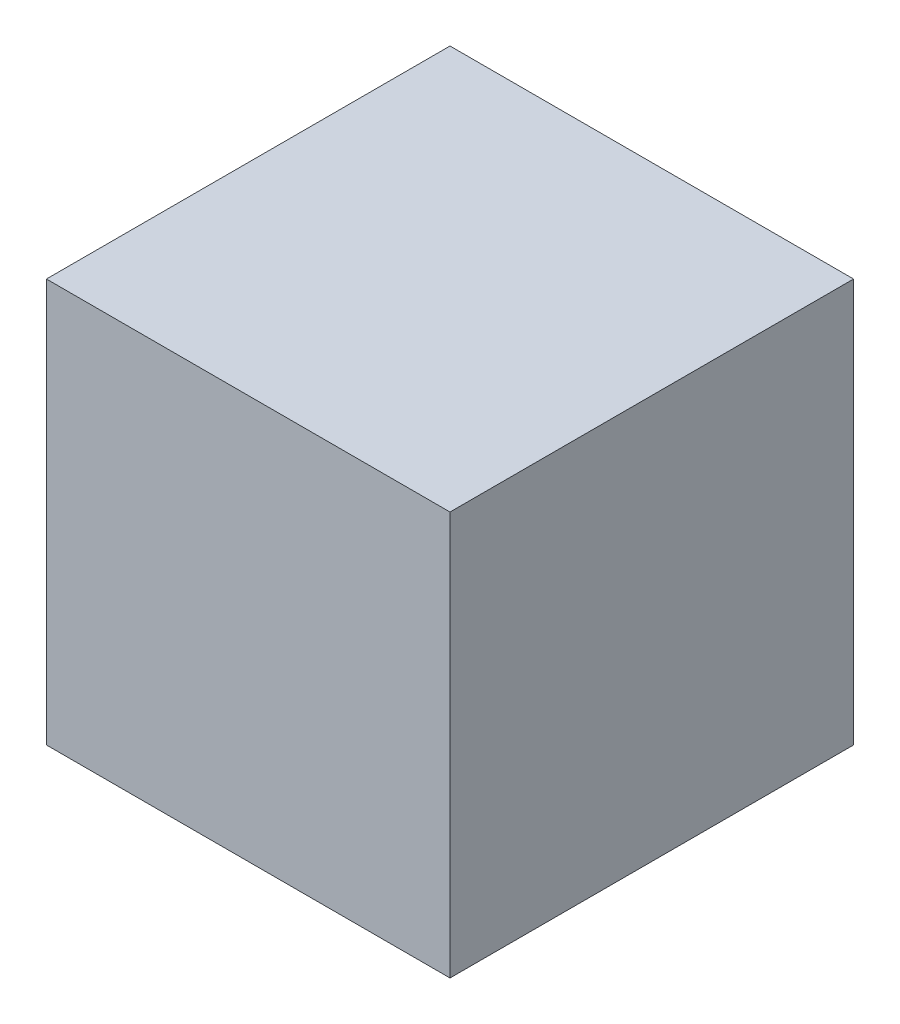
from build123d import *

# Parameters (mm, degrees)
SKETCH1_W           = 619.76
SKETCH1_H           = 619.76
BOSS_EXTRUDE1_DEPTH = 309.88


with BuildPart() as part:
    # Sketch1 → Boss-Extrude1 (new, symmetric)
    with BuildSketch(Plane(origin=(0, 0, 0), x_dir=(0, 0, -1), z_dir=(1, 0, 0))):
        Rectangle(SKETCH1_W, SKETCH1_H)
    extrude(amount=BOSS_EXTRUDE1_DEPTH, both=True)


solid = part.part
